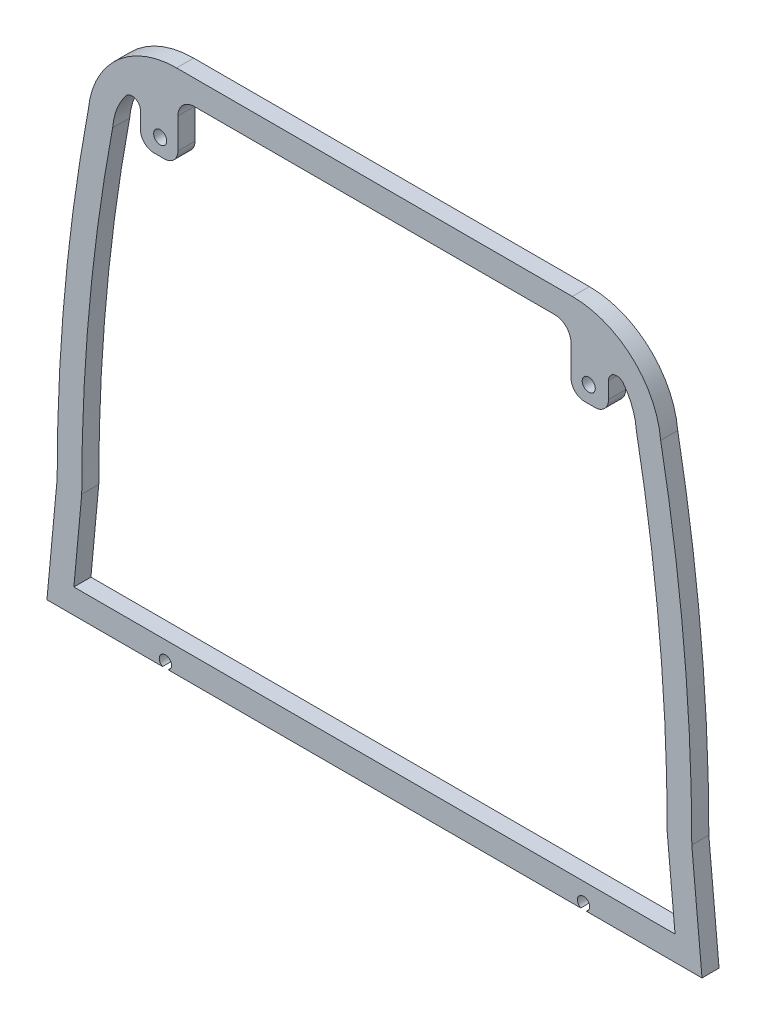
from build123d import *

# Parameters (mm, degrees)
SKETCH1_R           = 0.6096
BOSS_EXTRUDE1_DEPTH = 1.5875


with BuildPart() as part:
    # Sketch1 → Boss-Extrude1 (new body)
    with BuildSketch(Plane.XY):
        with BuildLine():
            Line((30.48, -22.225), (29.529304618, -11.9888))
            ThreePointArc((29.529304618, -11.9888), (28.804080885, 3.661869288), (26.634625221, 19.178404363))
            ThreePointArc((26.634625221, 19.178404363), (23.975715871, 24.516103507), (18.415, 26.67))
            Line((18.415, 26.67), (-18.415, 26.67))
            ThreePointArc((-18.415, 26.67), (-23.975715871, 24.516103507), (-26.634625221, 19.178404363))
            ThreePointArc((-26.634625221, 19.178404363), (-28.804080885, 3.661869288), (-29.529304618, -11.9888))
            Line((-29.529304618, -11.9888), (-30.48, -22.225))
            Line((-30.48, -22.225), (-19.719346062, -22.225))
            ThreePointArc((-19.719346062, -22.225), (-19.457528855, -21.1455), (-19.195711648, -22.225))
            Line((-19.195711648, -22.225), (19.195711648, -22.225))
            ThreePointArc((19.195711648, -22.225), (19.457528855, -21.1455), (19.719346062, -22.225))
            Line((19.719346062, -22.225), (30.48, -22.225))
        make_face()
        with BuildLine():
            Line((-16.773685627, 24.384), (16.773685627, 24.384))
            ThreePointArc((16.773685627, 24.384), (17.843769929, 23.940756569), (18.28701336, 22.870672267))
            Line((18.28701336, 22.870672267), (18.28701336, 20.039775045))
            ThreePointArc((18.28701336, 20.039775045), (18.658987748, 19.141749433), (19.55701336, 18.769775045))
            Line((19.55701336, 18.769775045), (20.512594083, 18.769775045))
            ThreePointArc((20.512594083, 18.769775045), (21.410619695, 19.141749433), (21.782594083, 20.039775045))
            Line((21.782594083, 20.039775045), (21.782594083, 21.575885307))
            ThreePointArc((21.782594083, 21.575885307), (22.302721492, 22.301099564), (23.156427057, 22.04099372))
            ThreePointArc((23.156427057, 22.04099372), (23.991734036, 20.543144377), (24.366662889, 18.869609567))
            ThreePointArc((24.366662889, 18.869609567), (26.527479635, 3.454742614), (27.24327124, -12.094369726))
            Line((27.24327124, -12.094369726), (27.971847643, -19.939))
            Line((27.971847643, -19.939), (-27.971847643, -19.939))
            Line((-27.971847643, -19.939), (-27.24327124, -12.094369726))
            ThreePointArc((-27.24327124, -12.094369726), (-26.527479635, 3.454742614), (-24.366662889, 18.869609567))
            ThreePointArc((-24.366662889, 18.869609567), (-23.991734036, 20.543144377), (-23.156427057, 22.04099372))
            ThreePointArc((-23.156427057, 22.04099372), (-22.302721492, 22.301099564), (-21.782594083, 21.575885307))
            Line((-21.782594083, 21.575885307), (-21.782594083, 20.039775045))
            ThreePointArc((-21.782594083, 20.039775045), (-21.410619695, 19.141749433), (-20.512594083, 18.769775045))
            Line((-20.512594083, 18.769775045), (-19.55701336, 18.769775045))
            ThreePointArc((-19.55701336, 18.769775045), (-18.658987748, 19.141749433), (-18.28701336, 20.039775045))
            Line((-18.28701336, 20.039775045), (-18.28701336, 22.870672267))
            ThreePointArc((-18.28701336, 22.870672267), (-17.843769929, 23.940756569), (-16.773685627, 24.384))
        make_face(mode=Mode.SUBTRACT)
        with Locations((19.939, 20.32)):
            Circle(SKETCH1_R, mode=Mode.SUBTRACT)
        with Locations((-19.939, 20.32)):
            Circle(SKETCH1_R, mode=Mode.SUBTRACT)
    extrude(amount=BOSS_EXTRUDE1_DEPTH)


solid = part.part
